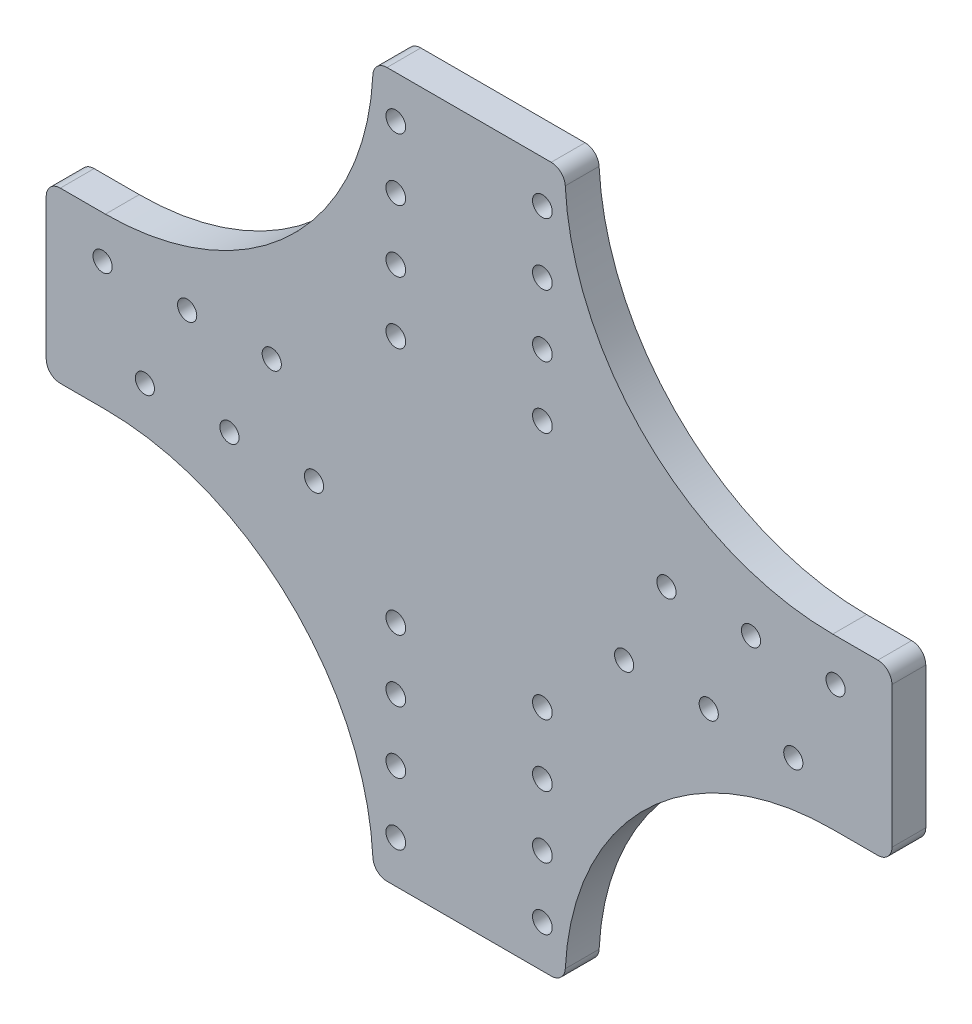
from build123d import *

# Parameters (mm, degrees)
BOSS_EXTRUDE1_DEPTH        = 6
F_7_0_7_DIAMETER_HOLE1_D   = 7
LPATTERN1_COUNT            = 4
LPATTERN1_PITCH            = 22
FILLET1_R                  = 5
MIRROR1_COPY_1_D           = 7
MIRROR1_COPY_2_D           = 7
MIRROR1_COPY_3_D           = 7
FILLET1_OF_MIRROR1_R       = 5
MIRROR5_COPY_1_D           = 7
MIRROR5_COPY_2_D           = 7
MIRROR5_COPY_3_D           = 7
FILLET1_OF_MIRROR5_R       = 5
MIRROR6_START              = -6
MIRROR6_OUTLINE_R          = 3.5
MIRROR6_DEPTH              = 12
F_6_8_6_8_DIAMETER_HOLE1_D = 6.8


# Read off the part's stored shape, not the designer's step: Mirror6
with BuildPart() as part:
    # Sketch1 → Boss-Extrude1 (new, symmetric)
    with BuildSketch(Plane.XY):
        with BuildLine():
            Line((0, 0), (0, 125))
            Line((0, 125), (34, 125))
            ThreePointArc((34, 125), (61.824855787, 57.824855787), (129, 30))
            Line((129, 30), (150, 30))
            Line((150, 30), (150, 0))
            Line((150, 0), (114.303256495, 0))
            Line((114.303256495, 0), (0, 0))
        make_face()
    boss_extrude1 = extrude(amount=BOSS_EXTRUDE1_DEPTH, both=True)

    # Ø7.0 (7) Diameter Hole1 (through all)
    with Locations(Plane.XY.offset(6)):
        with Locations((26, 110)):
            f_7_0_7_diameter_hole1 = Hole(F_7_0_7_DIAMETER_HOLE1_D / 2)

    # LPattern1: Ø7.0 (7) Diameter Hole1 ×4
    with Locations(*[(0, -i * LPATTERN1_PITCH, 0) for i in range(1, LPATTERN1_COUNT)]):
        add(f_7_0_7_diameter_hole1, mode=Mode.SUBTRACT)

    # Fillet1
    fillet1_edges = [part.edges().sort_by_distance(p)[0] for p in [
        (34, 125, 0),
        (150, 30, 0),
    ]]
    fillet(fillet1_edges, radius=FILLET1_R)

    # Mirror1: Boss-Extrude1, Ø7.0 (7) Diameter Hole1 across plane
    add(boss_extrude1.mirror(Plane(origin=(0, 0, 6), x_dir=(0, 0, 1), z_dir=(1, 0, 0))))
    add(f_7_0_7_diameter_hole1.mirror(Plane(origin=(0, 0, 6), x_dir=(0, 0, 1), z_dir=(1, 0, 0))), mode=Mode.SUBTRACT)

    # Mirror1 copy 1 (through all)
    with Locations(Plane(origin=(0, -22, 6), x_dir=(-1, 0, 0), z_dir=(0, 0, 1))):
        with Locations((26, -110)):
            Hole(MIRROR1_COPY_1_D / 2)

    # Mirror1 copy 2 (through all)
    with Locations(Plane(origin=(0, -44, 6), x_dir=(-1, 0, 0), z_dir=(0, 0, 1))):
        with Locations((26, -110)):
            Hole(MIRROR1_COPY_2_D / 2)

    # Mirror1 copy 3 (through all)
    with Locations(Plane(origin=(0, -66, 6), x_dir=(-1, 0, 0), z_dir=(0, 0, 1))):
        with Locations((26, -110)):
            Hole(MIRROR1_COPY_3_D / 2)

    # Fillet1 of Mirror1
    fillet1_of_mirror1_edges = [part.edges().sort_by_distance(p)[0] for p in [
        (-34, 125, 0),
        (-150, 30, 0),
    ]]
    fillet(fillet1_of_mirror1_edges, radius=FILLET1_OF_MIRROR1_R)

    # Mirror5: Boss-Extrude1, Ø7.0 (7) Diameter Hole1 across plane
    add(boss_extrude1.mirror(Plane.ZX))
    add(f_7_0_7_diameter_hole1.mirror(Plane.ZX), mode=Mode.SUBTRACT)

    # Mirror5 copy 1 (through all)
    with Locations(Plane(origin=(0, 22, 6), x_dir=(1, 0, 0), z_dir=(0, 0, 1))):
        with Locations((26, -110)):
            Hole(MIRROR5_COPY_1_D / 2)

    # Mirror5 copy 2 (through all)
    with Locations(Plane(origin=(0, 44, 6), x_dir=(1, 0, 0), z_dir=(0, 0, 1))):
        with Locations((26, -110)):
            Hole(MIRROR5_COPY_2_D / 2)

    # Mirror5 copy 3 (through all)
    with Locations(Plane(origin=(0, 66, 6), x_dir=(1, 0, 0), z_dir=(0, 0, 1))):
        with Locations((26, -110)):
            Hole(MIRROR5_COPY_3_D / 2)

    # Fillet1 of Mirror5
    fillet1_of_mirror5_edges = [part.edges().sort_by_distance(p)[0] for p in [
        (34, -125, 0),
        (150, -30, 0),
    ]]
    fillet(fillet1_of_mirror5_edges, radius=FILLET1_OF_MIRROR5_R)

    # Mirror6 outline → Mirror6 (add)
    with BuildSketch(Plane.XY.offset(MIRROR6_START)):
        with BuildLine():
            Line((0, 0), (-150, 0))
            Line((-150, 0), (-150, -25))
            ThreePointArc((-150, -25), (-148.535533906, -28.535533906), (-145, -30))
            Line((-145, -30), (-129, -30))
            ThreePointArc((-129, -30), (-63.525768428, -56.165960456), (-34.118824312, -120.25))
            ThreePointArc((-34.118824312, -120.25), (-32.571090411, -123.622844187), (-29.125078223, -125))
            Line((-29.125078223, -125), (0, -125))
            Line((0, -125), (0, 0))
        make_face()
        with Locations((-26, -110)):
            Circle(MIRROR6_OUTLINE_R, mode=Mode.SUBTRACT)
        with Locations((-26, -88)):
            Circle(MIRROR6_OUTLINE_R, mode=Mode.SUBTRACT)
        with Locations((-26, -66)):
            Circle(MIRROR6_OUTLINE_R, mode=Mode.SUBTRACT)
        with Locations((-26, -44)):
            Circle(MIRROR6_OUTLINE_R, mode=Mode.SUBTRACT)
    extrude(amount=MIRROR6_DEPTH)

    # Ø6.8 (6.8) Diameter Hole1 (through all)
    with Locations(Plane.XY.offset(6)):
        with Locations((130, 15), (100, 15), (70, 15), (115, -15), (85, -15), (55, -15)):
            f_6_8_6_8_diameter_hole1 = Hole(F_6_8_6_8_DIAMETER_HOLE1_D / 2)

    # Mirror7: Ø6.8 (6.8) Diameter Hole1 across plane
    add(f_6_8_6_8_diameter_hole1.mirror(Plane(origin=(0, 0, 0), x_dir=(0, 0, 1), z_dir=(1, 0, 0))), mode=Mode.SUBTRACT)


solid = part.part
